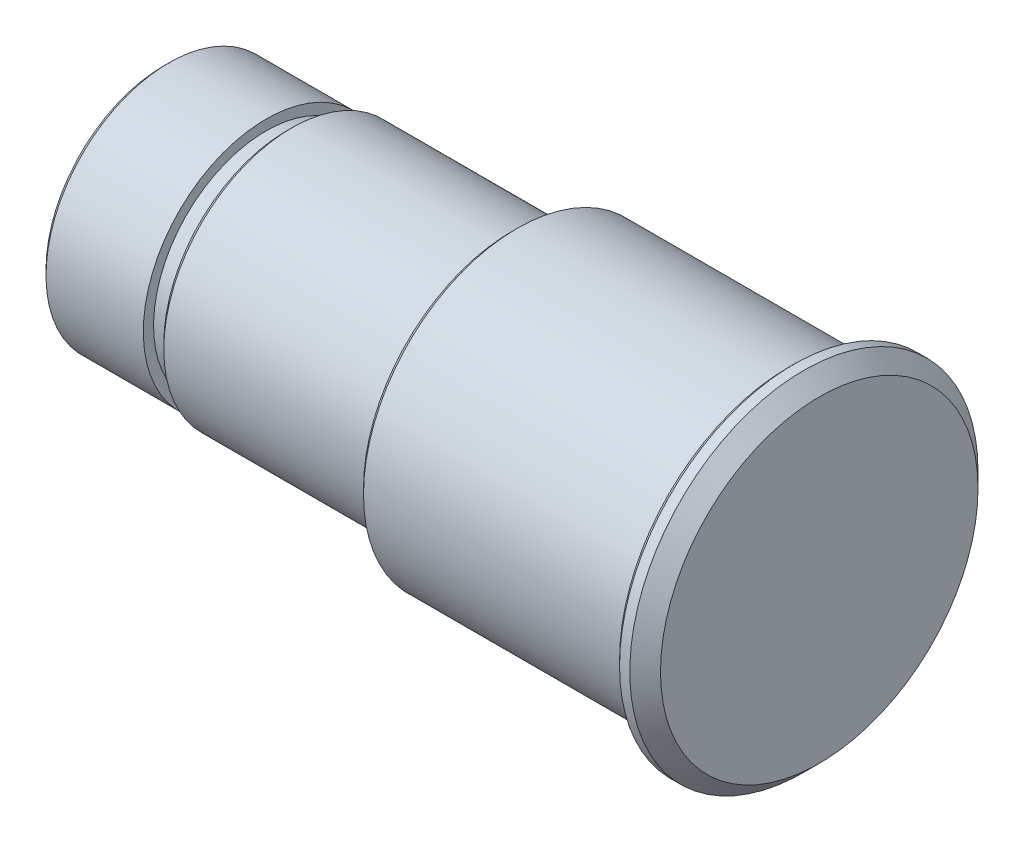
from build123d import *
from build123d.topology import SkipClean

# Parameters (mm, degrees)
CHAMFER_1_SIZE      = 1.5
CHAMFER_2_SIZE      = 0.5
CUT_EXTRUDE_START   = -3
CUT_EXTRUDE_1_DEPTH = 3


# Read off the part's stored shape, not the designer's step: 切除-拉伸1
with BuildPart() as part:
    # 草图1 → 旋转1 (revolve)
    with BuildSketch(Plane.XY, mode=Mode.PRIVATE) as revolve_1_sk:
        Polygon((0, 0), (0, 12), (10, 12), (10, 11), (12, 11), (12, 12.5), (34, 12.5), (34, 15), (61, 15), (61, 17), (64, 17), (64, 0), align=None)
    revolve(revolve_1_sk.sketch.rotate(Axis((0, 0, 0), (-1, 0, 0)), 90), axis=Axis((0, 0, 0), (-1, 0, 0)))

    # 倒角1
    chamfer_1_edges = [part.edges().sort_by_distance(p)[0] for p in [
        (64, 0, 17),
    ]]
    chamfer(chamfer_1_edges, length=CHAMFER_1_SIZE)

    # 倒角2
    chamfer_2_edges = [part.edges().sort_by_distance(p)[0] for p in [
        (61, 0, 17),
        (34, 0, 15),
        (34, 0, 12.5),
        (12, 0, 12.5),
        (0, 0, 12),
    ]]
    chamfer(chamfer_2_edges, length=CHAMFER_2_SIZE)

    # 切除-拉伸1 outline → 切除-拉伸1 (cut)
    with SkipClean():  # the faces are left unmerged after this step: merging them gives an invalid solid
        with BuildSketch(Plane(origin=(0, -9, 0), x_dir=(1, 0, 0), z_dir=(0, 1, 0)).offset(CUT_EXTRUDE_START)):
            with BuildLine():
                Line((9.5, 2.5), (0, 2.5))
                Line((0, 2.5), (0, -2.5))
                Line((0, -2.5), (9.5, -2.5))
                ThreePointArc((9.5, -2.5), (12, 0), (9.5, 2.5))
            make_face()
        extrude(amount=CUT_EXTRUDE_1_DEPTH, mode=Mode.SUBTRACT)


solid = part.part
